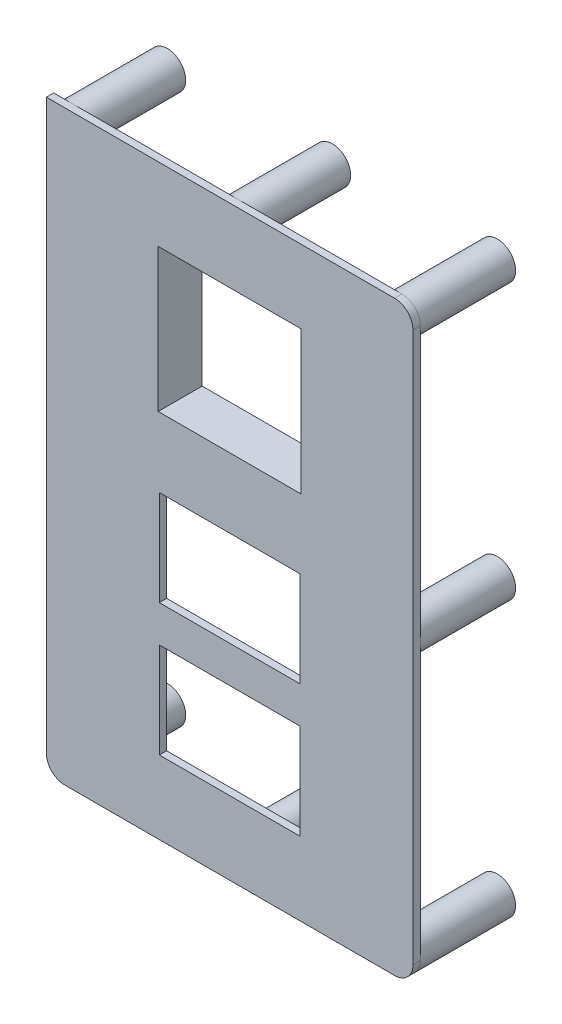
from build123d import *

# Parameters (mm, degrees)
SKETCH1_W           = 80
SKETCH1_H           = 50
BOSS_EXTRUDE1_DEPTH = 1
SKETCH4_W           = 19.2
SKETCH4_H           = 13
SKETCH4_W_2         = 19.5
SKETCH4_H_2         = 19.5
CUT_EXTRUDE1_DEPTH  = 1
SKETCH5_R           = 2.5
BOSS_EXTRUDE2_DEPTH = 13
FILLET1_R           = 2.5
SKETCH6_W           = 21.5
SKETCH6_H           = 21.5
SKETCH6_W_2         = 19.5
SKETCH6_H_2         = 19.5
BOSS_EXTRUDE3_DEPTH = 5
SKETCH7_R           = 1.5
CUT_EXTRUDE2_DEPTH  = 10


with BuildPart() as part:
    # Sketch1 → Boss-Extrude1 (new body)
    with BuildSketch(Plane(origin=(0, 0, 0), x_dir=(0, 1, 0), z_dir=(0, 0, 1))):
        Rectangle(SKETCH1_W, SKETCH1_H)
    extrude(amount=BOSS_EXTRUDE1_DEPTH)

    # Sketch4 → Cut-Extrude1 (cut)
    with BuildSketch(Plane(origin=(0, 0, 0), x_dir=(1, 0, 0), z_dir=(0, 0, -1))):
        with Locations((0, 23.5)):
            Rectangle(SKETCH4_W, SKETCH4_H)
        with Locations((0, 5.5)):
            Rectangle(SKETCH4_W, SKETCH4_H)
        with Locations((0, -20.25)):
            Rectangle(SKETCH4_W_2, SKETCH4_H_2)
    extrude(amount=-CUT_EXTRUDE1_DEPTH, mode=Mode.SUBTRACT)

    # Sketch5 → Boss-Extrude2 (add)
    with BuildSketch(Plane(origin=(0, 0, 0), x_dir=(1, 0, 0), z_dir=(0, 0, -1))):
        with Locations(Location((0, 37.5, 0), (0, 0, 90))):
            Circle(SKETCH5_R)
        with Locations(Location((-22.5, 37.5, 0), (0, 0, 180))):
            Circle(SKETCH5_R)
        with Locations((22.5, 37.5)):
            Circle(SKETCH5_R)
        with Locations(Location((-22.5, 0, 0), (0, 0, 180))):
            Circle(SKETCH5_R)
        with Locations((22.5, 0)):
            Circle(SKETCH5_R)
        with Locations((22.5, -37.5)):
            Circle(SKETCH5_R)
        with Locations(Location((-22.5, -37.5, 0), (0, 0, 180))):
            Circle(SKETCH5_R)
        with Locations(Location((0, -37.5, 0), (0, 0, 270))):
            Circle(SKETCH5_R)
    extrude(amount=BOSS_EXTRUDE2_DEPTH)

    # Fillet1
    fillet1_edges = [part.edges().sort_by_distance(p)[0] for p in [
        (25, 40, 0.5),
        (25, -40, 0.5),
        (-25, -40, 0.5),
    ]]
    fillet(fillet1_edges, radius=FILLET1_R - 0.0001)  # a hair under: the kernel refuses the full size

    # Sketch6 → Boss-Extrude3 (add)
    with BuildSketch(Plane(origin=(0, 0, 0), x_dir=(1, 0, 0), z_dir=(0, 0, -1))):
        with Locations((0, -20.25)):
            Rectangle(SKETCH6_W, SKETCH6_H)
        with Locations((0, -20.25)):
            Rectangle(SKETCH6_W_2, SKETCH6_H_2, mode=Mode.SUBTRACT)
    extrude(amount=BOSS_EXTRUDE3_DEPTH)

    # Sketch7 → Cut-Extrude2 (cut)
    with BuildSketch(Plane(origin=(0, 0, -13), x_dir=(1, 0, 0), z_dir=(0, 0, -1))):
        with Locations(Location((-22.5, 37.5, 0), (0, 0, 180))):
            Circle(SKETCH7_R)
        with Locations(Location((0, 37.5, 0), (0, 0, 180))):
            Circle(SKETCH7_R)
        with Locations(Location((22.5, 37.5, 0), (0, 0, 180))):
            Circle(SKETCH7_R)
        with Locations(Location((-22.5, 0, 0), (0, 0, 180))):
            Circle(SKETCH7_R)
        with Locations(Location((22.5, 0, 0), (0, 0, 180))):
            Circle(SKETCH7_R)
        with Locations(Location((22.5, -37.5, 0), (0, 0, 180))):
            Circle(SKETCH7_R)
        with Locations(Location((0, -37.5, 0), (0, 0, 180))):
            Circle(SKETCH7_R)
        with Locations(Location((-22.5, -37.5, 0), (0, 0, 180))):
            Circle(SKETCH7_R)
    extrude(amount=-CUT_EXTRUDE2_DEPTH, mode=Mode.SUBTRACT)


solid = part.part
